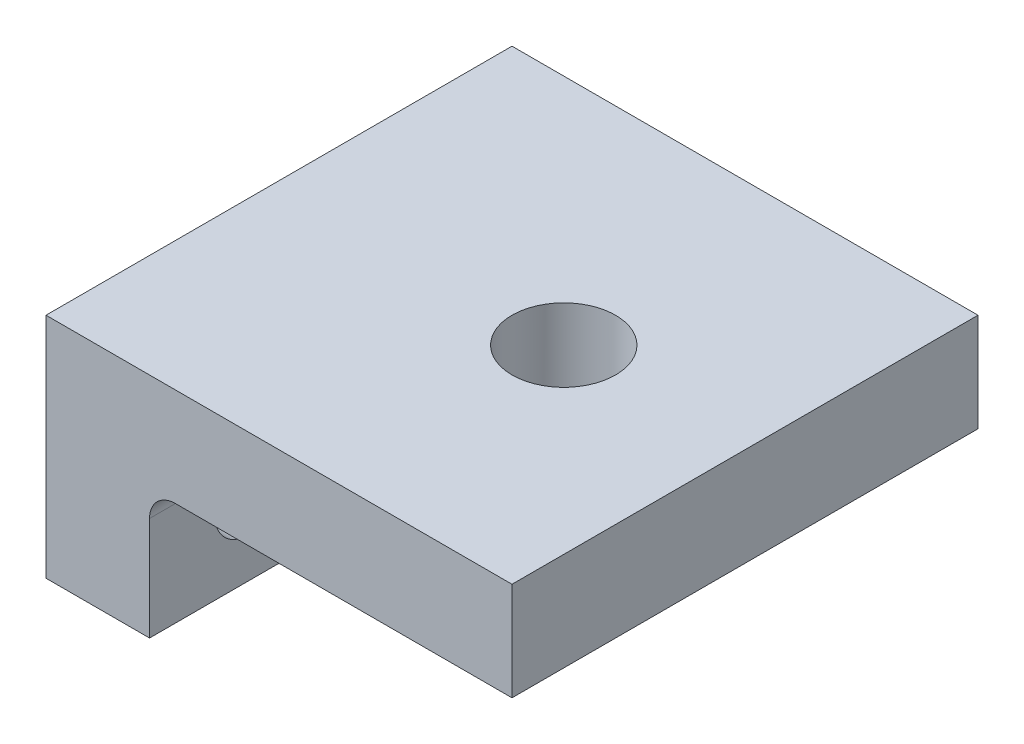
from build123d import *

# Parameters (mm, degrees)
BOSS_EXTRUDE1_DEPTH = 45.72
SKETCH2_R           = 1.7399
CUT_EXTRUDE1_DEPTH  = 45.72
FILLET1_R           = 2.54
SKETCH11_R          = 3.175
CUT_EXTRUDE5_DEPTH  = 2.54
SKETCH12_R          = 5.08
CUT_EXTRUDE6_DEPTH  = 69.412343214


with BuildPart() as part:
    # Sketch1 → Boss-Extrude1 (new body)
    with BuildSketch(Plane.XY):
        Polygon((0, 0), (0, -22.352), (10.16, -22.352), (10.16, -9.652), (45.72, -9.652), (45.72, 0), align=None)
    extrude(amount=BOSS_EXTRUDE1_DEPTH)

    # Sketch2 → Cut-Extrude1 (cut)
    with BuildSketch(Plane.ZY):
        with Locations((9.6139, -15.24)):
            Circle(SKETCH2_R)
        with Locations((36.1061, -15.24)):
            Circle(SKETCH2_R)
    extrude(amount=-CUT_EXTRUDE1_DEPTH, mode=Mode.SUBTRACT)

    # Fillet1
    fillet1_edges = [part.edges().sort_by_distance(p)[0] for p in [
        (10.16, -9.652, 22.86),
    ]]
    fillet(fillet1_edges, radius=FILLET1_R)

    # Sketch11 → Cut-Extrude5 (cut)
    with BuildSketch(Plane(origin=(10.16, 0, 0), x_dir=(0, 0, -1), z_dir=(1, 0, 0))):
        with Locations((-36.1061, -15.24)):
            Circle(SKETCH11_R)
        with Locations((-9.6139, -15.24)):
            Circle(SKETCH11_R)
    extrude(amount=-CUT_EXTRUDE5_DEPTH, mode=Mode.SUBTRACT)

    # Sketch12 → Cut-Extrude6 (cut, through all)
    with BuildSketch(Plane(origin=(0, 0, 0), x_dir=(1, 0, 0), z_dir=(0, 1, 0))):
        with Locations((27.94, -22.86)):
            Circle(SKETCH12_R)
    extrude(amount=-CUT_EXTRUDE6_DEPTH, mode=Mode.SUBTRACT)


solid = part.part
